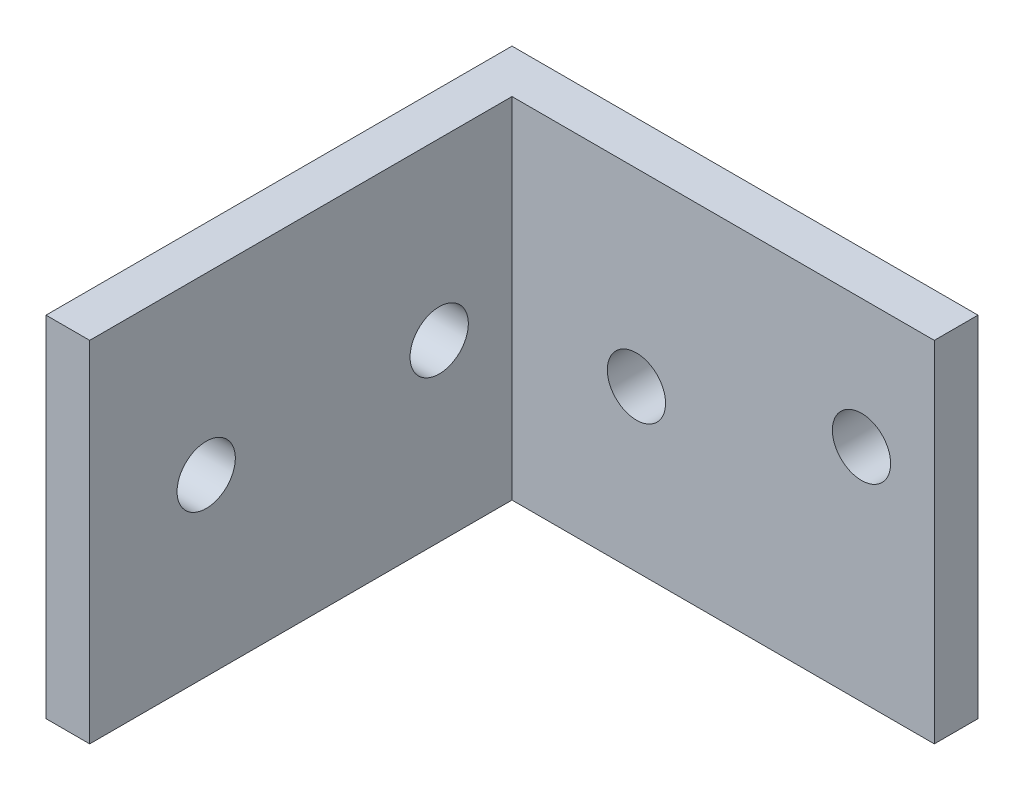
from build123d import *

# Parameters (mm, degrees)
BOSS_EXTRUDE1_DEPTH = 38.1
SKETCH2_R           = 3.175
CUT_EXTRUDE1_DEPTH  = 38.1
CUT_EXTRUDE3_REACH  = 83.32
SKETCH3_R           = 3.175


with BuildPart() as part:
    # Sketch1 → Boss-Extrude1 (new body)
    with BuildSketch(Plane(origin=(0, 0, 0), x_dir=(1, 0, 0), z_dir=(0, 1, 0))):
        Polygon((0, 0), (0, 46.0375), (46.0375, 46.0375), (46.0375, 50.8), (-4.7625, 50.8), (-4.7625, 0), align=None)
    extrude(amount=BOSS_EXTRUDE1_DEPTH)

    # Sketch2 → Cut-Extrude1 (cut)
    with BuildSketch(Plane(origin=(0, 0, -50.8), x_dir=(-1, 0, 0), z_dir=(0, 0, -1))):
        with Locations((-38.1, 24.078433028)):
            Circle(SKETCH2_R)
        with Locations((-13.565484012, 17.504429282)):
            Circle(SKETCH2_R)
    extrude(amount=-CUT_EXTRUDE1_DEPTH, mode=Mode.SUBTRACT)

    # Sketch3 → Cut-Extrude3 (cut, up to next)
    with BuildSketch(Plane.ZY.offset(4.7625), mode=Mode.PRIVATE) as cut_extrude3_sk1:
        with Locations((-12.7, 19.05)):
            Circle(SKETCH3_R)
    cut_extrude3_tool1 = extrude(cut_extrude3_sk1.sketch, amount=-CUT_EXTRUDE3_REACH, mode=Mode.PRIVATE) & part.part
    # Sketch3 → Cut-Extrude3 (cut, up to next)
    with BuildSketch(Plane.ZY.offset(4.7625), mode=Mode.PRIVATE) as cut_extrude3_sk2:
        with Locations((-38.1, 19.05)):
            Circle(SKETCH3_R)
    cut_extrude3_tool2 = extrude(cut_extrude3_sk2.sketch, amount=-CUT_EXTRUDE3_REACH, mode=Mode.PRIVATE) & part.part
    add(cut_extrude3_tool1.solids().sort_by_distance((-4.7625, 19.05, -12.7))[0], mode=Mode.SUBTRACT)
    add(cut_extrude3_tool2.solids().sort_by_distance((-4.7625, 19.05, -38.1))[0], mode=Mode.SUBTRACT)


solid = part.part
